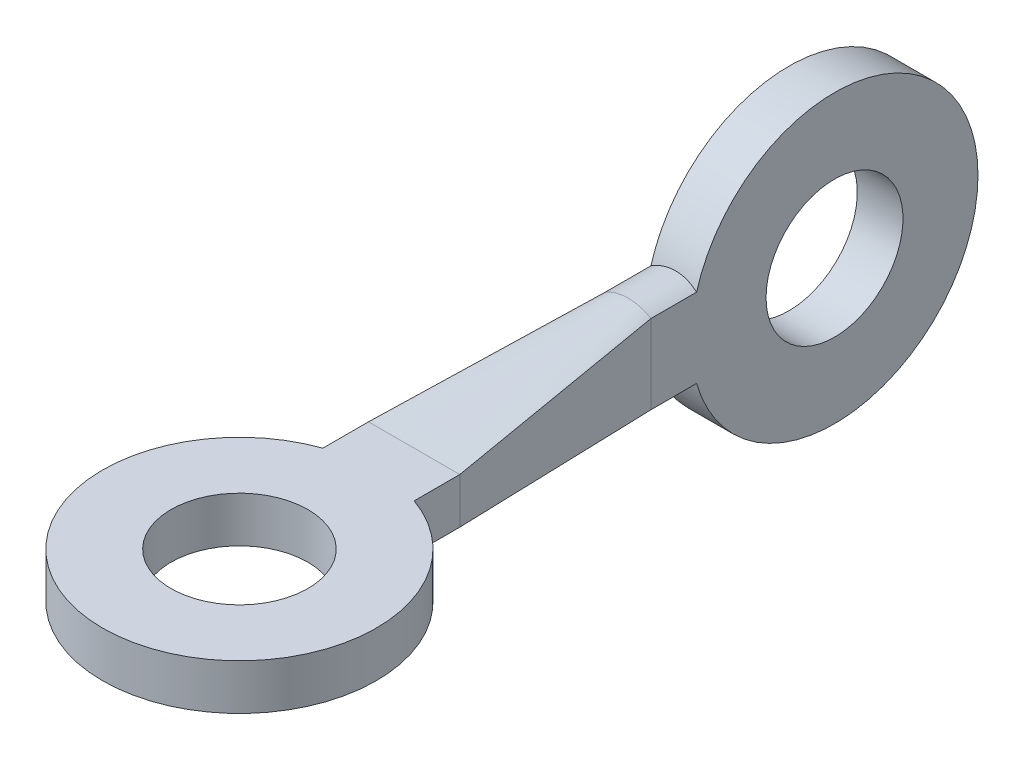
from build123d import *
from build123d.topology import SkipClean

# Parameters (mm, degrees)
SKETCH1_R               = 2
BOSS_EXTRUDE1_DEPTH     = 40
BOSS_EXTRUDE2_START     = 50
BOSS_EXTRUDE2_DEPTH     = 50
SKETCH6_R               = 6.287980689
SKETCH6_R_2             = 2
BOSS_EXTRUDE4_DEPTH     = 2
SKETCH7_R               = 6
BOSS_EXTRUDE5_DEPTH     = 2
CUT_EXTRUDE1_DEPTH      = 64.851309322
CUT_EXTRUDE1_DEPTH_BACK = 64.851309322
SKETCH9_R               = 6
CUT_EXTRUDE2_DEPTH      = 63.85322908
SKETCH11_R              = 2
CUT_EXTRUDE3_DEPTH      = 2
SKETCH13_R              = 6
CUT_EXTRUDE4_DEPTH      = 10
CUT_EXTRUDE5_DEPTH      = 10
CUT_EXTRUDE5_DEPTH_BACK = 10
SKETCH14_W              = 2
SKETCH14_H              = 2
SKETCH17_R              = 3
CUT_EXTRUDE6_DEPTH      = 63.598150172
SKETCH21_W              = 9.38
SKETCH21_H              = 6.916039478
CUT_EXTRUDE7_DEPTH      = 10
SKETCH22_W              = 4
SKETCH22_H              = 2
BOSS_EXTRUDE6_DEPTH     = 2
SKETCH23_R              = 6
SKETCH23_R_2            = 3
BOSS_EXTRUDE7_DEPTH     = 2


with BuildPart() as part:
    # Sketch1 → Boss-Extrude1 (new body)
    with BuildSketch(Plane.XY):
        Circle(SKETCH1_R)
    extrude(amount=BOSS_EXTRUDE1_DEPTH)

    # Sketch2 → Revolve1 (revolve)
    with BuildSketch(Plane(origin=(0, 0, 0), x_dir=(1, 0, 0), z_dir=(0, 1, 0))):
        with BuildLine():
            Line((-9, -40), (9, -40))
            ThreePointArc((9, -40), (0, -31), (-9, -40))
        make_face()
    revolve(axis=Axis((-9, 0, 40), (1, 0, 0)))

    # Sketch3 → Boss-Extrude2 (add)
    with SkipClean():  # the faces are left unmerged after this step: merging them gives an invalid solid
        with BuildSketch(Plane(origin=(0, 0, 0), x_dir=(-1, 0, 0), z_dir=(0, 0, -1)).offset(BOSS_EXTRUDE2_START)):
            with BuildLine():
                Line((1, -1.732050808), (1, 1.732050808))
                ThreePointArc((1, 1.732050808), (0, 2), (-1, 1.732050808))
                Line((-1, 1.732050808), (-1, -1.732050808))
                ThreePointArc((-1, -1.732050808), (0, -2), (1, -1.732050808))
            make_face()
        extrude(amount=-BOSS_EXTRUDE2_DEPTH)

    # Sketch6 → Boss-Extrude4 (add)
    with SkipClean():  # the faces are left unmerged after this step: merging them gives an invalid solid
        with BuildSketch(Plane.ZY.offset(1)):
            with Locations((-55.961434487, 0)):
                Circle(SKETCH6_R)
            with Locations((-55.961434487, 0)):
                Circle(SKETCH6_R_2, mode=Mode.SUBTRACT)
        extrude(amount=-BOSS_EXTRUDE4_DEPTH)

    # Sketch7 → Boss-Extrude5 (add)
    with SkipClean():  # the faces are left unmerged after this step: merging them gives an invalid solid
        with BuildSketch(Plane(origin=(0, 0, 0), x_dir=(1, 0, 0), z_dir=(0, 1, 0))):
            with Locations((0, 30.624189127)):
                Circle(SKETCH7_R)
        extrude(amount=BOSS_EXTRUDE5_DEPTH)

    # Sketch8 → Cut-Extrude1 (cut, two sides: drawn at the far end of the back side and taken through both)
    with BuildSketch(Plane(origin=(0, 2, 0), x_dir=(1, 0, 0), z_dir=(0, 1, 0)).offset(-CUT_EXTRUDE1_DEPTH_BACK)):
        with BuildLine():
            ThreePointArc((0, 24.624189127), (-4.242640687, 26.38154844), (-6, 30.624189127))
            Line((-6, 30.624189127), (-27.198688651, -55.120065689))
            Line((-27.198688651, -55.120065689), (28.23800577, -55.120065689))
            Line((28.23800577, -55.120065689), (6, 30.624189127))
            ThreePointArc((6, 30.624189127), (4.242640687, 26.38154844), (0, 24.624189127))
        make_face()
    extrude(amount=CUT_EXTRUDE1_DEPTH + CUT_EXTRUDE1_DEPTH_BACK, mode=Mode.SUBTRACT)

    # Sketch9 → Cut-Extrude2 (cut, through all)
    with BuildSketch(Plane.XZ):
        with Locations((0, -30.624189127)):
            Circle(SKETCH9_R)
    extrude(amount=CUT_EXTRUDE2_DEPTH, mode=Mode.SUBTRACT)

    # Sketch11 → Cut-Extrude3 (cut)
    with BuildSketch(Plane(origin=(0, 2, 0), x_dir=(1, 0, 0), z_dir=(0, 1, 0))):
        with Locations(Location((0, 30.624189127, 0), (0, 0, 270))):
            Circle(SKETCH11_R)
    extrude(amount=-CUT_EXTRUDE3_DEPTH, mode=Mode.SUBTRACT)

    # Sketch13 → Cut-Extrude4 (cut)
    with BuildSketch(Plane.XZ):
        with Locations((0, -30.624189127)):
            Circle(SKETCH13_R)
    extrude(amount=-CUT_EXTRUDE4_DEPTH, mode=Mode.SUBTRACT)

    # Sketch14 → Cut-Extrude5 (cut, two sides: drawn at the far end of the back side and taken through both)
    with BuildSketch(Plane(origin=(0, 0, 0), x_dir=(1, 0, 0), z_dir=(0, 1, 0)).offset(-CUT_EXTRUDE5_DEPTH_BACK)):
        with Locations((0, 37.54026891)):
            Rectangle(SKETCH14_W, SKETCH14_H)
    extrude(amount=CUT_EXTRUDE5_DEPTH + CUT_EXTRUDE5_DEPTH_BACK, mode=Mode.SUBTRACT)

    # Sketch17 → Cut-Extrude6 (cut, through all)
    with BuildSketch(Plane.ZY.offset(1)):
        with Locations((-55.961434487, 0)):
            Circle(SKETCH17_R)
    extrude(amount=-CUT_EXTRUDE6_DEPTH, mode=Mode.SUBTRACT)

    # Sketch21 → Cut-Extrude7 (cut)
    with BuildSketch(Plane.ZY.offset(1)):
        with Locations((-43.23026891, -0.033704231)):
            Rectangle(SKETCH21_W, SKETCH21_H)
    extrude(amount=-CUT_EXTRUDE7_DEPTH, mode=Mode.SUBTRACT)

    # Loft1: read off the stored shape, not the designer's step
    # Loft1: loft between two sections, ruled curve by curve
    loft1_from = [
        Edge.make_bspline([(-2, 1, -38.54026891), (-1.666666667, 1, -38.54026891), (-1.333333333, 1, -38.54026891), (-0.666666667, 1, -38.54026891), (-0.333333333, 1, -38.54026891), (0.333333333, 1, -38.54026891), (0.666666667, 1, -38.54026891), (1.333333333, 1, -38.54026891), (1.666666667, 1, -38.54026891), (2, 1, -38.54026891)], [0, 0, 0, 0, 0.25, 0.25, 0.5, 0.5, 0.75, 0.75, 1, 1, 1, 1], 3),
        Edge.make_bspline([(2, -1, -38.54026891), (1.666666667, -1, -38.54026891), (1.333333333, -1, -38.54026891), (0.666666667, -1, -38.54026891), (0.333333333, -1, -38.54026891), (-0.333333333, -1, -38.54026891), (-0.666666667, -1, -38.54026891), (-1.333333333, -1, -38.54026891), (-1.666666667, -1, -38.54026891), (-2, -1, -38.54026891)], [0, 0, 0, 0, 0.25, 0.25, 0.5, 0.5, 0.75, 0.75, 1, 1, 1, 1], 3),
        Edge.make_line((2, -1, -38.54026891), (2, 1, -38.54026891)),
        Edge.make_line((-2, 1, -38.54026891), (-2, -1, -38.54026891)),
    ]
    loft1_to = [
        Edge.make_bspline([(-1, 1.732050808, -47.92026891), (-0.855662433, 1.815384141, -47.92026891), (-0.695743587, 1.883277768, -47.92026891), (-0.357154512, 1.975660635, -47.92026891), (-0.178632795, 2, -47.92026891), (0.178632795, 2, -47.92026891), (0.357154512, 1.975660635, -47.92026891), (0.695743587, 1.883277768, -47.92026891), (0.855662433, 1.815384141, -47.92026891), (1, 1.732050808, -47.92026891)], [0, 0, 0, 0, 0.25, 0.25, 0.5, 0.5, 0.75, 0.75, 1, 1, 1, 1], 3),
        Edge.make_bspline([(1, -1.732050808, -47.92026891), (0.855662433, -1.815384141, -47.92026891), (0.695743587, -1.883277768, -47.92026891), (0.357154512, -1.975660635, -47.92026891), (0.178632795, -2, -47.92026891), (-0.178632795, -2, -47.92026891), (-0.357154512, -1.975660635, -47.92026891), (-0.695743587, -1.883277768, -47.92026891), (-0.855662433, -1.815384141, -47.92026891), (-1, -1.732050808, -47.92026891)], [0, 0, 0, 0, 0.25, 0.25, 0.5, 0.5, 0.75, 0.75, 1, 1, 1, 1], 3),
        Edge.make_line((1, -1.732050808, -47.92026891), (1, 1.732050808, -47.92026891)),
        Edge.make_line((-1, 1.732050808, -47.92026891), (-1, -1.732050808, -47.92026891)),
    ]
    loft1 = Solid(Shell([*[Face.make_surface_from_curves(loft1_from[k], loft1_to[k]) for k in range(4)], Face(Wire(loft1_from)), Face(Wire(loft1_to))]))
    add(loft1)

    # Sketch22 → Boss-Extrude6 (add)
    with BuildSketch(Plane.XY.offset(-38.54026891)):
        Rectangle(SKETCH22_W, SKETCH22_H)
    extrude(amount=BOSS_EXTRUDE6_DEPTH)

    # Sketch23 → Boss-Extrude7 (add)
    with BuildSketch(Plane.XZ.offset(1)):
        with Locations((0, -30.883414661)):
            Circle(SKETCH23_R)
        with Locations(Location((0, -30.883414661, 0), (0, 0, 270))):
            Circle(SKETCH23_R_2, mode=Mode.SUBTRACT)
    extrude(amount=-BOSS_EXTRUDE7_DEPTH)


solid = part.part
